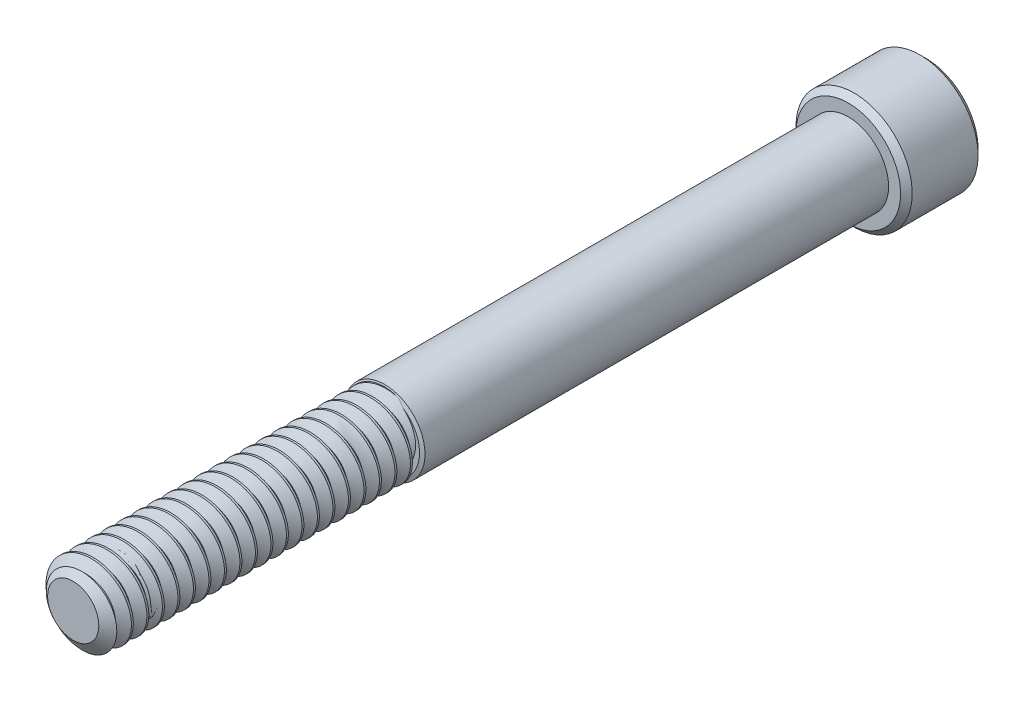
from build123d import *

# Parameters (mm, degrees)
SKETCH1_R          = 3.175
EXTRUDE1_DEPTH     = 63.5
CUT_SWEEP1_PITCH   = 1.27
SKETCH6_R          = 4.7625
EXTRUDE2_DEPTH     = 6.35
CUT_EXTRUDE1_DEPTH = 3.571875
CHAMFER1_SIZE      = 0.47625


with BuildPart() as part:
    # Sketch1 → Extrude1 (new body)
    with BuildSketch(Plane.XY):
        Circle(SKETCH1_R)
    extrude(amount=-EXTRUDE1_DEPTH)

    # Cut-Sweep1: the profile of Sketch3 profile screwed along a right-hand helix of 51 turns, 6 arcs to a turn; built about Z, then put on its axis
    cut_sweep1_z = Axis((0, 0, 0), (0, 0, 1))
    cut_sweep1_corners = [(3.1753, 0, -1.111423205), (2.350110803, 0, -0.635), (2.350110803, 0, -0.47625), (3.1753, 0, 0.000173205)]
    with BuildLine(mode=Mode.PRIVATE) as cut_sweep1_profile:
        Line(cut_sweep1_corners[0], cut_sweep1_corners[1])
        Line(cut_sweep1_corners[1], cut_sweep1_corners[2])
        Line(cut_sweep1_corners[2], cut_sweep1_corners[3])
        Line(cut_sweep1_corners[3], cut_sweep1_corners[0])
    cut_sweep1_cap = Face(cut_sweep1_profile.wire())
    cut_sweep1_turn_angles = [0, 30, 60, 90, 120, 150, 180, 210, 240, 270, 300, 330, 360, 390, 420, 450, 480, 510, 540, 570, 600, 630, 660, 690, 720]
    cut_sweep1_turn_weights = [1, 0.8660254037844387, 1, 0.8660254037844387, 1, 0.8660254037844387, 1, 0.8660254037844387, 1, 0.8660254037844387, 1, 0.8660254037844387, 1, 0.8660254037844387, 1, 0.8660254037844387, 1, 0.8660254037844387, 1, 0.8660254037844387, 1, 0.8660254037844387, 1, 0.8660254037844387, 1]
    cut_sweep1_turn_rails = [Edge.make_bspline([Vector(p[0], p[1], 0).rotate(cut_sweep1_z, cut_sweep1_turn_angles[k]) / cut_sweep1_turn_weights[k] + Vector(0, 0, p[2] + CUT_SWEEP1_PITCH * cut_sweep1_turn_angles[k] / 360) for k in range(25)], [0, 0, 0, 1, 1, 2, 2, 3, 3, 4, 4, 5, 5, 6, 6, 7, 7, 8, 8, 9, 9, 10, 10, 11, 11, 12, 12, 12], 2, cut_sweep1_turn_weights) for p in cut_sweep1_corners]
    cut_sweep1_turn_sides = [Face.make_surface_from_curves(cut_sweep1_turn_rails[p[0]], cut_sweep1_turn_rails[p[1]]) for p in [(0, 1), (1, 2), (2, 3), (3, 0)]]
    cut_sweep1_last_angles = [18000, 18030, 18060, 18090, 18120, 18150, 18180, 18210, 18240, 18270, 18300, 18330, 18360]
    cut_sweep1_last_weights = [1, 0.8660254037844387, 1, 0.8660254037844387, 1, 0.8660254037844387, 1, 0.8660254037844387, 1, 0.8660254037844387, 1, 0.8660254037862324, 1]
    cut_sweep1_last_rails = [Edge.make_bspline([Vector(p[0], p[1], 0).rotate(cut_sweep1_z, cut_sweep1_last_angles[k]) / cut_sweep1_last_weights[k] + Vector(0, 0, p[2] + CUT_SWEEP1_PITCH * cut_sweep1_last_angles[k] / 360) for k in range(13)], [0, 0, 0, 1, 1, 2, 2, 3, 3, 4, 4, 5, 5, 6, 6, 6], 2, cut_sweep1_last_weights) for p in cut_sweep1_corners]
    cut_sweep1_last_sides = [Face.make_surface_from_curves(cut_sweep1_last_rails[p[0]], cut_sweep1_last_rails[p[1]]) for p in [(0, 1), (1, 2), (2, 3), (3, 0)]]
    cut_sweep1 = Plane(origin=(0, 0, 0), x_dir=(0, 1, 0), z_dir=(0, 0, -1)) * Solid(Shell([*[p.moved(Location((0, 0, 2 * CUT_SWEEP1_PITCH * i))) for i in range(25) for p in cut_sweep1_turn_sides], *cut_sweep1_last_sides, cut_sweep1_cap, cut_sweep1_cap.rotate(cut_sweep1_z, 18360).moved(Location((0, 0, CUT_SWEEP1_PITCH * 18360 / 360)))]))
    add(cut_sweep1, mode=Mode.SUBTRACT)

    # Sketch4 → Cut-Revolve1 (revolve, cut)
    with BuildSketch(Plane(origin=(0, 0, 0), x_dir=(0, 0, -1), z_dir=(1, 0, 0)), mode=Mode.PRIVATE) as cut_revolve1_sk:
        Polygon((0.755446349, 3.175), (0, 2.096110803), (0, 3.175), align=None)
    revolve(cut_revolve1_sk.sketch.rotate(Axis((0, 0, 0), (0, 0, -1)), 270), axis=Axis((0, 0, 0), (0, 0, -1)), mode=Mode.SUBTRACT)

    # Sketch5 → partially thread (revolve)
    with BuildSketch(Plane(origin=(0, 0, 0), x_dir=(0, 0, -1), z_dir=(1, 0, 0)), mode=Mode.PRIVATE) as partially_thread_sk:
        Polygon((63.5, 3.302), (25.520182971, 3.302), (25.4, 2.9718), (25.4, 0), (63.5, 0), align=None)
    revolve(partially_thread_sk.sketch.rotate(Axis((0, 0, 0), (0, 0, -1)), 270), axis=Axis((0, 0, 0), (0, 0, -1)))

    # Sketch6 → Extrude2 (add)
    with BuildSketch(Plane(origin=(0, 0, -63.5), x_dir=(-1, 0, 0), z_dir=(0, 0, -1))):
        Circle(SKETCH6_R)
    extrude(amount=EXTRUDE2_DEPTH)

    # Sketch7 → Cut-Extrude1 (cut)
    with BuildSketch(Plane(origin=(0, 0, -69.85), x_dir=(-1, 0, 0), z_dir=(0, 0, -1))):
        Polygon((0, 2.749630657), (-2.38125, 1.374815329), (-2.38125, -1.374815329), (0, -2.749630657), (2.38125, -1.374815329), (2.38125, 1.374815329), align=None)
    extrude(amount=-CUT_EXTRUDE1_DEPTH, mode=Mode.SUBTRACT)

    # Cut-Extrude2 cone 1 section (through the dimple's axis) → Cut-Extrude2 (revolve, cut)
    with BuildSketch(Plane(origin=(0, 0, -69.85), x_dir=(0, 1, 0), z_dir=(1, 0, 0))):
        Polygon((0, 0), (2.749630657, 0), (0, 2.749630657), align=None)
    revolve(axis=Axis((0, 0, -69.85), (0, 0, 1)), mode=Mode.SUBTRACT)

    # Chamfer1
    chamfer1_edges = [part.edges().sort_by_distance(p)[0] for p in [
        (4.7625, 0, -63.5),
        (4.7625, 0, -69.85),
    ]]
    chamfer(chamfer1_edges, length=CHAMFER1_SIZE)


solid = part.part
